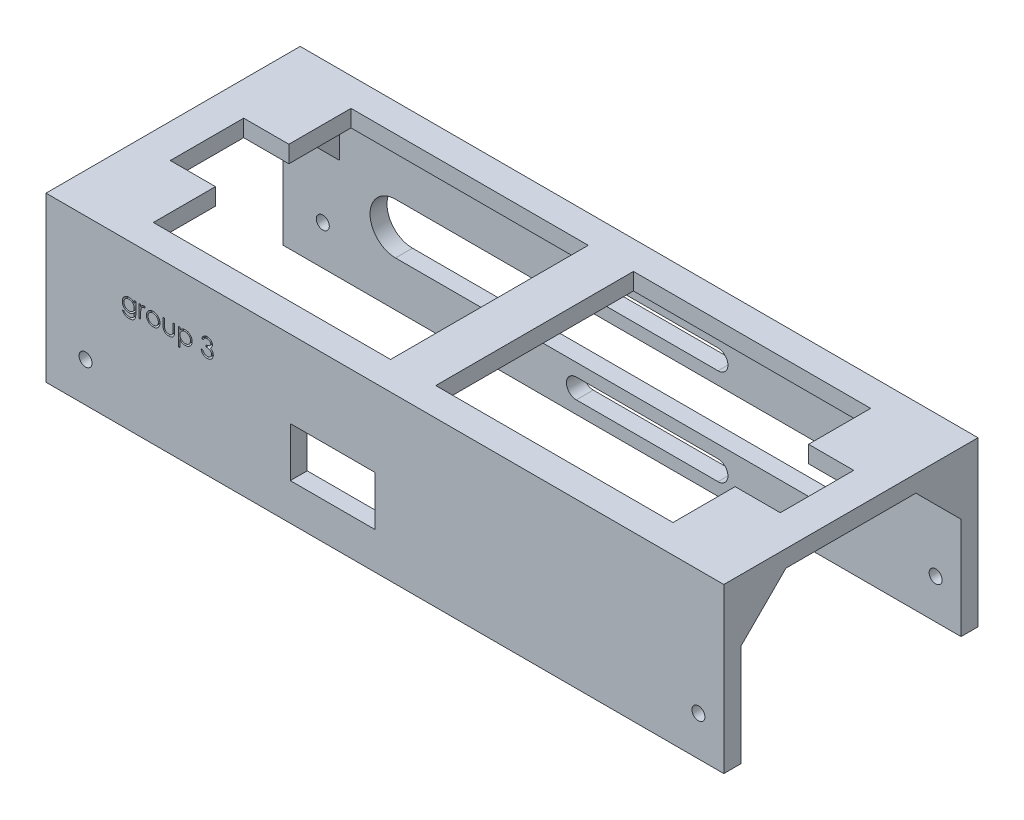
from build123d import *

# Parameters (mm, degrees)
SKETCH1_W           = 120
SKETCH1_H           = 29
BOSS_EXTRUDE5_DEPTH = 45
SHELL9_T            = -3
SKETCH3_R           = 1.15
CUT_EXTRUDE2_DEPTH  = 79
CUT_EXTRUDE8_DEPTH  = 23
SKETCH7_W           = 15
SKETCH7_H           = 8.75
CUT_EXTRUDE9_DEPTH  = 20
SKETCH13_W          = 50
SKETCH13_H          = 35
CUT_EXTRUDE14_DEPTH = 10
SKETCH17_W          = 8
SKETCH17_H          = 11
BOSS_EXTRUDE6_DEPTH = 3
CUT_EXTRUDE15_DEPTH = 1.5
BOSS_EXTRUDE7_DEPTH = 10
BOSS_EXTRUDE8_DEPTH = 10


with BuildPart() as part:
    # Sketch1 → Boss-Extrude5 (new body)
    with BuildSketch(Plane.XY):
        with Locations((60, 14.5)):
            Rectangle(SKETCH1_W, SKETCH1_H)
    extrude(amount=BOSS_EXTRUDE5_DEPTH)

    # Shell9
    shell9_openings = [part.faces().sort_by_distance(p)[0] for p in [
        (120, 14.5, 22.5),
        (60, 0, 22.5),
        (0, 14.5, 22.5),
    ]]
    offset(amount=SHELL9_T, openings=shell9_openings, kind=Kind.INTERSECTION)

    # Sketch3 → Cut-Extrude2 (cut)
    with BuildSketch(Plane(origin=(0, 0, 0), x_dir=(-1, 0, 0), z_dir=(0, 0, -1))):
        with Locations((-7, 7)):
            Circle(SKETCH3_R)
        with Locations((-115.5, 7)):
            Circle(SKETCH3_R)
    extrude(amount=-CUT_EXTRUDE2_DEPTH, mode=Mode.SUBTRACT)

    # Sketch6 → Cut-Extrude8 (cut)
    with BuildSketch(Plane(origin=(0, 0, 0), x_dir=(-1, 0, 0), z_dir=(0, 0, -1))):
        with BuildLine():
            Line((-51.883496676, 22.75), (-76.973496676, 22.75))
            ThreePointArc((-76.973496676, 22.75), (-78.723496676, 21), (-76.973496676, 19.25))
            Line((-76.973496676, 19.25), (-51.883496676, 19.25))
            ThreePointArc((-51.883496676, 19.25), (-50.133496676, 21), (-51.883496676, 22.75))
        make_face()
        with BuildLine():
            Line((-19.873496676, 17), (-94.873496676, 17))
            ThreePointArc((-94.873496676, 17), (-99.373496676, 12.5), (-94.873496676, 8))
            Line((-94.873496676, 8), (-19.873496676, 8))
            ThreePointArc((-19.873496676, 8), (-15.373496676, 12.5), (-19.873496676, 17))
        make_face()
        with BuildLine():
            ThreePointArc((-76.973496676, 5.75), (-78.723496676, 4), (-76.973496676, 2.25))
            Line((-76.973496676, 2.25), (-51.883496676, 2.25))
            ThreePointArc((-51.883496676, 2.25), (-50.133496676, 4), (-51.883496676, 5.75))
            Line((-51.883496676, 5.75), (-76.973496676, 5.75))
        make_face()
    extrude(amount=-CUT_EXTRUDE8_DEPTH, mode=Mode.SUBTRACT)

    # Sketch7 → Cut-Extrude9 (cut)
    with BuildSketch(Plane.XY.offset(45)):
        with Locations((50.746172795, 10.921245049)):
            Rectangle(SKETCH7_W, SKETCH7_H)
    extrude(amount=-CUT_EXTRUDE9_DEPTH, mode=Mode.SUBTRACT)

    # Sketch13 → Cut-Extrude14 (cut)
    with BuildSketch(Plane(origin=(0, 29, 0), x_dir=(1, 0, 0), z_dir=(0, 1, 0))):
        with Locations((89, -22.5)):
            Rectangle(SKETCH13_W, SKETCH13_H)
        with Locations((31, -22.5)):
            Rectangle(SKETCH13_W, SKETCH13_H)
    extrude(amount=-CUT_EXTRUDE14_DEPTH, mode=Mode.SUBTRACT)

    # Sketch17 → Boss-Extrude6 (add)
    with BuildSketch(Plane(origin=(0, 29, 0), x_dir=(1, 0, 0), z_dir=(0, 1, 0))):
        with Locations((10, -10.5)):
            Rectangle(SKETCH17_W, SKETCH17_H)
        with Locations((10, -34.5)):
            Rectangle(SKETCH17_W, SKETCH17_H)
        with Locations((110, -10.5)):
            Rectangle(SKETCH17_W, SKETCH17_H)
        with Locations((110, -34.5)):
            Rectangle(SKETCH17_W, SKETCH17_H)
    extrude(amount=-BOSS_EXTRUDE6_DEPTH)

    # Sketch20 → Cut-Extrude15 (cut)
    # profile 1 of 6: a face of its own
    with BuildSketch(Plane.XY.offset(45)):
        with BuildLine():
            Line((15.616704574, 20.332761713), (15.901640472, 20.332761713))
            Line((15.901640472, 20.332761713), (15.901640472, 18.49149068))
            add(Edge.make_bspline(
                [(15.901640472, 18.49149068), (15.901389155, 18.452268005), (15.900904052, 18.376558794), (15.897410671, 18.267086354), (15.890044057, 18.165970691), (15.881690467, 18.072750642), (15.869673803, 17.9878583), (15.854999527, 17.91104035), (15.838457161, 17.842223075), (15.823924535, 17.799836969), (15.817050127, 17.779786954)],
                knots=[0, 0, 0, 0, 1.307562039, 2.523909702, 3.650326591, 4.686913197, 5.643429486, 6.506965704, 7.293745905, 8, 8, 8, 8], degree=3))
            add(Edge.make_bspline(
                [(15.817050127, 17.779786954), (15.806899889, 17.753724811), (15.786902899, 17.702379766), (15.749450931, 17.629595775), (15.707510176, 17.561064407), (15.659606909, 17.497167576), (15.605957751, 17.438226048), (15.547826683, 17.382959277), (15.484081581, 17.332536497), (15.414758892, 17.287827692), (15.341456639, 17.247562292), (15.264216961, 17.212685764), (15.183475406, 17.182308413), (15.098473497, 17.159554734), (15.010543928, 17.139838237), (14.918652687, 17.127006986), (14.823336649, 17.118273869), (14.758525483, 17.117466301), (14.725643877, 17.117056585)],
                knots=[0, 0, 0, 0, 0.981931301, 1.934503488, 2.87077864, 3.801706999, 4.735015492, 5.667491629, 6.616593066, 7.585388521, 8.561939025, 9.551802639, 10.560317337, 11.588439944, 12.640189604, 13.723962949, 14.845264515, 16, 16, 16, 16], degree=3))
            add(Edge.make_bspline(
                [(14.725643877, 17.117056585), (14.677669868, 17.11783354), (14.583963739, 17.119351142), (14.447343495, 17.137032186), (14.317590571, 17.162027939), (14.196419457, 17.19986072), (14.084595869, 17.246158561), (13.982883496, 17.299312554), (13.89219542, 17.360262855), (13.810440374, 17.429659829), (13.736651931, 17.512176883), (13.667230747, 17.609421549), (13.600409749, 17.722875084), (13.561249628, 17.806144188), (13.540743036, 17.849748893)],
                knots=[0, 0, 0, 0, 1.157897085, 2.2616841, 3.32207898, 4.345638746, 5.321241055, 6.241986252, 7.112515963, 7.955008012, 8.825025602, 9.77857164, 10.836726669, 12, 12, 12, 12], degree=3))
            Line((13.540743036, 17.849748893), (13.825678933, 17.849748893))
            add(Edge.make_bspline(
                [(13.825678933, 17.849748893), (13.848595366, 17.813367134), (13.89339417, 17.742245276), (13.977167435, 17.650158342), (14.068976031, 17.571460647), (14.171918315, 17.508041587), (14.286422618, 17.460226276), (14.412557826, 17.426140115), (14.55135034, 17.405732787), (14.647977577, 17.403273256), (14.698295119, 17.401992483)],
                knots=[0, 0, 0, 0, 0.997731894, 1.950442991, 2.880492273, 3.800895997, 4.748200782, 5.754801363, 6.83083817, 8, 8, 8, 8], degree=3))
            add(Edge.make_bspline(
                [(14.698295119, 17.401992483), (14.747976513, 17.403289832), (14.843757266, 17.405790991), (14.981489827, 17.426149222), (15.107215235, 17.460233694), (15.220209131, 17.507957016), (15.319138293, 17.566422742), (15.404420599, 17.631737095), (15.473494698, 17.705379862), (15.519952175, 17.773217644), (15.548830721, 17.833655247), (15.567220536, 17.885682245), (15.582164779, 17.944513069), (15.594665061, 18.009950487), (15.604980103, 18.08208799), (15.611514147, 18.161090521), (15.616236561, 18.246778529), (15.616544963, 18.306190162), (15.616704574, 18.336938396)],
                knots=[0, 0, 0, 0, 1.570740765, 3.028230971, 4.391408896, 5.680370741, 6.894727393, 8.017376726, 9.065722033, 10.075533815, 10.603371122, 11.180248986, 11.817768598, 12.521299649, 13.286540596, 14.121245857, 15.027658897, 16, 16, 16, 16], degree=3))
            Line((15.616704574, 18.336938396), (15.616704574, 18.457145728))
            add(Edge.make_bspline(
                [(15.616704574, 18.457145728), (15.587783846, 18.422727093), (15.530451097, 18.354495237), (15.431438879, 18.265085752), (15.323292106, 18.188081905), (15.206194892, 18.124927858), (15.083015558, 18.074416852), (14.955088249, 18.039090023), (14.823559742, 18.016266399), (14.734431006, 18.013810477), (14.689390872, 18.012569406)],
                knots=[0, 0, 0, 0, 1.012485704, 2.007162095, 2.997754123, 3.998611389, 4.999708251, 5.992315798, 6.98544096, 8, 8, 8, 8], degree=3))
            add(Edge.make_bspline(
                [(14.689390872, 18.012569406), (14.662869399, 18.013036608), (14.610140308, 18.013965485), (14.531804216, 18.022092376), (14.454624104, 18.033884092), (14.378779973, 18.051193683), (14.304162381, 18.073411178), (14.230894637, 18.101184934), (14.158383509, 18.132585791), (14.087947043, 18.169572548), (14.020286767, 18.210722641), (13.955913021, 18.255298635), (13.895162989, 18.303067225), (13.838614888, 18.354499449), (13.786342893, 18.409520868), (13.737643956, 18.467544948), (13.693323362, 18.52938192), (13.652471645, 18.593904232), (13.617040867, 18.661541641), (13.585940044, 18.730827485), (13.558898655, 18.801613615), (13.537340041, 18.874137022), (13.520874388, 18.948351984), (13.508618682, 19.02413692), (13.501667308, 19.1017252), (13.500583341, 19.153995995), (13.500037908, 19.180297771)],
                knots=[0, 0, 0, 0, 1.028754217, 2.045334182, 3.052854819, 4.056607503, 5.061168794, 6.071104265, 7.095078842, 8.125279047, 9.155117945, 10.165957491, 11.161587969, 12.151493252, 13.128948131, 14.104219989, 15.088194871, 16.07871515, 17.064853787, 18.047899887, 19.02414258, 20.002704429, 20.980574569, 21.971845993, 22.979467364, 24, 24, 24, 24], degree=3))
            add(Edge.make_bspline(
                [(13.500037908, 19.180297771), (13.500508866, 19.206607723), (13.501448958, 19.259125723), (13.509568775, 19.337030594), (13.521151346, 19.413892296), (13.53948268, 19.488918582), (13.561546682, 19.562963892), (13.588873066, 19.635481306), (13.621728655, 19.706492911), (13.658930356, 19.776051293), (13.700735212, 19.843223058), (13.746575391, 19.907019373), (13.796506234, 19.966970786), (13.8498389, 20.023682111), (13.907224591, 20.07660618), (13.96863362, 20.125614541), (14.033460661, 20.171528693), (14.101906631, 20.213358264), (14.172915405, 20.250353587), (14.24468294, 20.284110729), (14.31815991, 20.310902394), (14.391976428, 20.334509063), (14.467432493, 20.351232418), (14.543602915, 20.364134024), (14.620748464, 20.371994163), (14.672412876, 20.372975315), (14.698295119, 20.373466842)],
                knots=[0, 0, 0, 0, 1.008818848, 2.013730394, 3.001654427, 3.987803273, 4.973046549, 5.963777569, 6.957074694, 7.972068341, 8.987420212, 9.989399531, 10.982630087, 11.977756091, 12.973280677, 13.973972381, 14.989194003, 16.018387222, 17.047741039, 18.059210846, 19.057554164, 20.045176975, 21.029480261, 22.018708529, 23.007435371, 24, 24, 24, 24], degree=3))
            add(Edge.make_bspline(
                [(14.698295119, 20.373466842), (14.740977042, 20.372236145), (14.825260726, 20.369805898), (14.949295278, 20.350736716), (15.068985739, 20.320334718), (15.18500751, 20.276777682), (15.298305708, 20.217314433), (15.408506924, 20.138989044), (15.515929996, 20.04109895), (15.582222028, 19.966030281), (15.616704574, 19.926982467)],
                knots=[0, 0, 0, 0, 0.96728863, 1.910097829, 2.838038873, 3.762875196, 4.71315279, 5.730631239, 6.819562287, 8, 8, 8, 8], degree=3))
            Line((15.616704574, 19.926982467), (15.616704574, 20.332761713))
        make_face()
        with BuildLine():
            add(Edge.make_bspline(
                [(14.721191754, 20.088530944), (14.679526044, 20.087114835), (14.597036773, 20.084311238), (14.476125205, 20.060376534), (14.359396844, 20.022869897), (14.249083349, 19.969219095), (14.145753328, 19.903819322), (14.054064026, 19.824589204), (13.973868138, 19.734105154), (13.90602933, 19.633185287), (13.852025876, 19.524307938), (13.813795774, 19.409544629), (13.78907611, 19.290749742), (13.78634774, 19.209676024), (13.784973805, 19.168849454)],
                knots=[0, 0, 0, 0, 1.026226791, 2.031711442, 3.026614839, 4.04107745, 5.047145931, 6.032893242, 7.017642609, 8.019221815, 9.021877557, 10.003543541, 10.994637589, 12, 12, 12, 12], degree=3))
            add(Edge.make_bspline(
                [(13.784973805, 19.168849454), (13.78563217, 19.138067128), (13.786926982, 19.077527295), (13.799376227, 18.988683633), (13.819497532, 18.904065063), (13.848015569, 18.823666466), (13.883351228, 18.747026688), (13.927794307, 18.674673668), (13.980091974, 18.60654297), (14.039834895, 18.543138509), (14.105672041, 18.485388916), (14.177081601, 18.434645122), (14.25396672, 18.393142682), (14.334436469, 18.357273494), (14.42044337, 18.331076054), (14.510748612, 18.311083733), (14.605991079, 18.299645788), (14.670916871, 18.298228108), (14.704019278, 18.297505303)],
                knots=[0, 0, 0, 0, 1.039728707, 2.044842319, 3.024901384, 3.974314358, 4.923051295, 5.871625912, 6.837440708, 7.820715446, 8.810779094, 9.792721783, 10.773906224, 11.758876063, 12.764959493, 13.806266761, 14.881525401, 16, 16, 16, 16], degree=3))
            add(Edge.make_bspline(
                [(14.704019278, 18.297505303), (14.737550687, 18.298201634), (14.803121003, 18.299563302), (14.898888923, 18.311268619), (14.989632909, 18.330157126), (15.075269755, 18.356975013), (15.1561228, 18.39119403), (15.231283772, 18.434497961), (15.302364264, 18.483814268), (15.367094722, 18.541338023), (15.425627358, 18.604733697), (15.476636696, 18.673717281), (15.520101946, 18.747250752), (15.556095261, 18.825325821), (15.583573711, 18.908549241), (15.60200586, 18.996712964), (15.614893407, 19.089394606), (15.616091675, 19.152902422), (15.616704574, 19.185385912)],
                knots=[0, 0, 0, 0, 1.121943988, 2.193949579, 3.223793937, 4.220241907, 5.192961521, 6.155822191, 7.11847367, 8.083710714, 9.04790392, 10.001595906, 10.949595423, 11.902125208, 12.873731292, 13.87582262, 14.913508608, 16, 16, 16, 16], degree=3))
            add(Edge.make_bspline(
                [(15.616704574, 19.185385912), (15.615489395, 19.227674965), (15.613115361, 19.310292915), (15.59071151, 19.430676912), (15.554588891, 19.543859923), (15.503927909, 19.649483987), (15.440444229, 19.746429935), (15.363980388, 19.83290228), (15.27585506, 19.909012343), (15.176321441, 19.97241999), (15.069235544, 20.023642205), (14.957184173, 20.062070384), (14.840333683, 20.083836656), (14.761134297, 20.086957176), (14.721191754, 20.088530944)],
                knots=[0, 0, 0, 0, 1.070913519, 2.092188694, 3.091357305, 4.074328408, 5.051968682, 6.018948707, 6.99050112, 7.9935919, 9.000589572, 9.992915277, 10.987769056, 12, 12, 12, 12], degree=3))
        make_face(mode=Mode.SUBTRACT)
    # profile 2 of 6: a face of its own
    with BuildSketch(Plane.XY.offset(45)):
        with BuildLine():
            Line((16.471512267, 20.332761713), (16.756448164, 20.332761713))
            Line((16.756448164, 20.332761713), (16.756448164, 19.991220247))
            add(Edge.make_bspline(
                [(16.756448164, 19.991220247), (16.777483681, 20.023020891), (16.817713944, 20.083839376), (16.884582101, 20.1642751), (16.953074409, 20.230873035), (17.023518757, 20.283944084), (17.096433176, 20.323688842), (17.170217411, 20.352801809), (17.246032302, 20.370016945), (17.29697919, 20.372315336), (17.322503853, 20.373466842)],
                knots=[0, 0, 0, 0, 1.2804753, 2.448899062, 3.506932113, 4.484331642, 5.4025378, 6.288909075, 7.142734305, 8, 8, 8, 8], degree=3))
            add(Edge.make_bspline(
                [(17.322503853, 20.373466842), (17.342303449, 20.372386864), (17.383042405, 20.37016474), (17.444712326, 20.354552063), (17.508251743, 20.329625571), (17.549202337, 20.306184798), (17.570550728, 20.293964638)],
                knots=[0, 0, 0, 0, 0.901110191, 1.854092781, 2.881294221, 4, 4, 4, 4], degree=3))
            Line((17.570550728, 20.293964638), (17.414090392, 20.047189798))
            add(Edge.make_bspline(
                [(17.414090392, 20.047189798), (17.400384351, 20.053304183), (17.374367662, 20.064910455), (17.336308877, 20.078646421), (17.301219379, 20.08673443), (17.278864151, 20.087959724), (17.268442355, 20.088530944)],
                knots=[0, 0, 0, 0, 1.180555205, 2.24091978, 3.179933427, 4, 4, 4, 4], degree=3))
            add(Edge.make_bspline(
                [(17.268442355, 20.088530944), (17.245577154, 20.08700691), (17.198938771, 20.083898323), (17.130463547, 20.059460976), (17.064017868, 20.019977365), (17.01124786, 19.976188571), (16.970388102, 19.933963069), (16.941232326, 19.897089161), (16.914487262, 19.855742831), (16.888932848, 19.810630903), (16.865649853, 19.760983115), (16.843919546, 19.707295485), (16.824271863, 19.649505833), (16.813068427, 19.609244546), (16.807329574, 19.588621088)],
                knots=[0, 0, 0, 0, 1.125678352, 2.296057538, 3.5422874, 4.923748041, 5.663163013, 6.437101912, 7.23742474, 8.08941207, 8.991984279, 9.93940061, 10.944477711, 12, 12, 12, 12], degree=3))
            add(Edge.make_bspline(
                [(16.807329574, 19.588621088), (16.803036618, 19.570226795), (16.793528044, 19.529484834), (16.784282864, 19.461132958), (16.775148372, 19.380375782), (16.768710726, 19.286988515), (16.762743502, 19.18120437), (16.759377927, 19.06286219), (16.756562935, 18.931840507), (16.756487582, 18.840242344), (16.756448164, 18.792327018)],
                knots=[0, 0, 0, 0, 0.566838948, 1.255505196, 2.06880316, 3.007127437, 4.065329342, 5.249902469, 6.561414163, 8, 8, 8, 8], degree=3))
            Line((16.756448164, 18.792327018), (16.756448164, 18.012569406))
            Line((16.756448164, 18.012569406), (16.471512267, 18.012569406))
            Line((16.471512267, 18.012569406), (16.471512267, 20.332761713))
        make_face()
    # profile 3 of 6: a face of its own
    with BuildSketch(Plane.XY.offset(45)):
        with BuildLine():
            add(Edge.make_bspline(
                [(18.976149687, 20.373466842), (19.019684627, 20.37253984), (19.105046006, 20.370722218), (19.230057445, 20.351295784), (19.349387675, 20.321589247), (19.463493721, 20.280521473), (19.570914218, 20.225474275), (19.673213846, 20.159788703), (19.770112133, 20.081971636), (19.828190167, 20.021775389), (19.857670119, 19.991220247)],
                knots=[0, 0, 0, 0, 1.054011418, 2.066658804, 3.057071809, 4.030435133, 4.997543892, 5.974964718, 6.972108034, 8, 8, 8, 8], degree=3))
            add(Edge.make_bspline(
                [(19.857670119, 19.991220247), (19.883053749, 19.96199756), (19.933329765, 19.904117725), (19.997796525, 19.810268705), (20.053333226, 19.713077328), (20.09784034, 19.611252967), (20.132933183, 19.505684516), (20.157848493, 19.39600912), (20.172668427, 19.282468991), (20.174666833, 19.205358366), (20.175678933, 19.166305383)],
                knots=[0, 0, 0, 0, 1.025258237, 2.030674902, 3.01204498, 3.988269485, 4.97094183, 5.956517959, 6.965070386, 8, 8, 8, 8], degree=3))
            add(Edge.make_bspline(
                [(20.175678933, 19.166305383), (20.17478872, 19.127026045), (20.173029618, 19.049408242), (20.156389337, 18.935090674), (20.130507566, 18.824242513), (20.093467256, 18.717327841), (20.045970971, 18.614019848), (19.98801299, 18.514769757), (19.919186595, 18.41938175), (19.841168683, 18.328665797), (19.754943053, 18.245057873), (19.661401975, 18.172188657), (19.562383673, 18.109757703), (19.456571489, 18.059468955), (19.344931697, 18.019818012), (19.227223499, 17.991968712), (19.103629757, 17.975130613), (19.019240778, 17.972968371), (18.976149687, 17.971864278)],
                knots=[0, 0, 0, 0, 0.998656419, 1.973391657, 2.932242238, 3.890759089, 4.846373663, 5.82037756, 6.809684879, 7.83454468, 8.860553229, 9.859544525, 10.845671541, 11.83227036, 12.833544569, 13.85385346, 14.904124723, 16, 16, 16, 16], degree=3))
            add(Edge.make_bspline(
                [(18.976149687, 17.971864278), (18.932847477, 17.972972077), (18.848037911, 17.975141758), (18.724007913, 17.991903293), (18.606088759, 18.019805177), (18.494302816, 18.05959926), (18.388035705, 18.10975931), (18.288443668, 18.171999915), (18.194826602, 18.245079484), (18.10858273, 18.328659941), (18.03056971, 18.419383259), (17.961742052, 18.514769365), (17.903784399, 18.61401995), (17.856288029, 18.717327814), (17.819247741, 18.824242521), (17.793365964, 18.935090672), (17.776725685, 19.049408242), (17.774966583, 19.127026045), (17.774076369, 19.166305383)],
                knots=[0, 0, 0, 0, 1.099876186, 2.154163076, 3.173186993, 4.173200201, 5.163417411, 6.152872554, 7.150605724, 8.17532212, 9.198891216, 10.186952605, 11.159729845, 12.11414092, 13.071450619, 14.029093627, 15.002601286, 16, 16, 16, 16], degree=3))
            add(Edge.make_bspline(
                [(17.774076369, 19.166305383), (17.775095372, 19.205146107), (17.777112823, 19.282044065), (17.791917856, 19.395370756), (17.816735975, 19.50486053), (17.851870885, 19.610021498), (17.896788237, 19.711399643), (17.951544548, 19.808831168), (18.016668907, 19.902255816), (18.066744963, 19.960060846), (18.092085183, 19.989312194)],
                knots=[0, 0, 0, 0, 1.031353054, 2.041901799, 3.029428768, 4.008703097, 4.981709435, 5.96992636, 6.972712378, 8, 8, 8, 8], degree=3))
            add(Edge.make_bspline(
                [(18.092085183, 19.989312194), (18.121520691, 20.020132318), (18.179410796, 20.080745514), (18.276791428, 20.158335732), (18.378839394, 20.22538817), (18.487447005, 20.279341594), (18.601459312, 20.321830821), (18.721401054, 20.351372396), (18.8468367, 20.370652225), (18.932615785, 20.372519286), (18.976149687, 20.373466842)],
                knots=[0, 0, 0, 0, 1.027980169, 2.021703884, 2.998553061, 3.971491411, 4.943284454, 5.930300938, 6.949603206, 8, 8, 8, 8], degree=3))
        make_face()
        with BuildLine():
            add(Edge.make_bspline(
                [(18.974877651, 20.088530944), (18.94409139, 20.087655922), (18.883313609, 20.085928465), (18.793851557, 20.072789495), (18.707727274, 20.05197283), (18.624777366, 20.022396294), (18.545281559, 19.984206578), (18.469163744, 19.937299709), (18.396200031, 19.882296955), (18.327817731, 19.819284389), (18.26505949, 19.750451301), (18.210197326, 19.67711029), (18.163547408, 19.600450961), (18.124685264, 19.520393598), (18.095740886, 19.436126908), (18.074719644, 19.348605193), (18.061593069, 19.257650137), (18.059881854, 19.195818356), (18.059012267, 19.16439733)],
                knots=[0, 0, 0, 0, 1.021534396, 2.016698045, 2.994645724, 3.958388632, 4.93408049, 5.916473867, 6.921342795, 7.962252576, 8.998418191, 10.008913653, 10.997312074, 11.973003931, 12.956656626, 13.948281152, 14.957379055, 16, 16, 16, 16], degree=3))
            add(Edge.make_bspline(
                [(18.059012267, 19.16439733), (18.060469885, 19.123800849), (18.063362986, 19.043224424), (18.08688995, 18.924560048), (18.126247504, 18.810639368), (18.179394536, 18.702130218), (18.245984463, 18.601734651), (18.324440588, 18.512225519), (18.413920888, 18.434949819), (18.513358713, 18.370832194), (18.620722987, 18.319887273), (18.734348364, 18.283783917), (18.852858136, 18.260314596), (18.933848514, 18.257981901), (18.974877651, 18.256800175)],
                knots=[0, 0, 0, 0, 1.016792936, 2.018143844, 3.017858371, 4.030088057, 5.03801393, 6.028138512, 7.003788237, 7.991172063, 8.984598303, 9.972568034, 10.972917682, 12, 12, 12, 12], degree=3))
            add(Edge.make_bspline(
                [(18.974877651, 18.256800175), (19.015904429, 18.257988786), (19.096890148, 18.260335072), (19.215235258, 18.283665716), (19.328550076, 18.320045465), (19.435802834, 18.370774898), (19.535195396, 18.435193303), (19.625319242, 18.51178916), (19.703105482, 18.601971725), (19.769629538, 18.702263197), (19.82364694, 18.810471145), (19.862820273, 18.924581074), (19.886403798, 19.043219069), (19.889289264, 19.123799055), (19.890743036, 19.16439733)],
                knots=[0, 0, 0, 0, 1.02726834, 2.027799167, 3.010890988, 4.004497153, 4.992059811, 5.971914811, 6.958719428, 7.966827853, 8.981595046, 9.981490638, 10.983022906, 12, 12, 12, 12], degree=3))
            add(Edge.make_bspline(
                [(19.890743036, 19.16439733), (19.889873748, 19.195818544), (19.888163122, 19.257650694), (19.875032262, 19.348603063), (19.854026879, 19.436134725), (19.825024055, 19.520364757), (19.786330771, 19.600658243), (19.738781252, 19.67688521), (19.684143107, 19.750705362), (19.620627576, 19.819061879), (19.552316655, 19.882321519), (19.47932337, 19.937321037), (19.403318425, 19.984000427), (19.324053568, 20.022722945), (19.241093025, 20.051703747), (19.155089415, 20.072909691), (19.066009066, 20.085872941), (19.005449077, 20.087639276), (18.974877651, 20.088530944)],
                knots=[0, 0, 0, 0, 1.042956736, 2.052379634, 3.044323526, 4.02829302, 5.004299113, 5.996692471, 7.007513377, 8.048758398, 9.090003419, 10.095195979, 11.07790575, 12.047570684, 13.018257071, 13.989683339, 14.985167495, 16, 16, 16, 16], degree=3))
        make_face(mode=Mode.SUBTRACT)
    # profile 4 of 6: a face of its own
    with BuildSketch(Plane.XY.offset(45)):
        with BuildLine():
            Line((20.7048456, 20.332761713), (20.989781497, 20.332761713))
            Line((20.989781497, 20.332761713), (20.989781497, 19.256619887))
            add(Edge.make_bspline(
                [(20.989781497, 19.256619887), (20.989910225, 19.225030678), (20.990156476, 19.164602003), (20.991826473, 19.077647655), (20.995754486, 18.998348208), (21.000665598, 18.926657854), (21.00698125, 18.86258872), (21.014495442, 18.806364589), (21.022894153, 18.757347865), (21.031115329, 18.727826393), (21.034938749, 18.71409685)],
                knots=[0, 0, 0, 0, 1.388932606, 2.656963016, 3.823490214, 4.879454478, 5.816252168, 6.653371382, 7.373723809, 8, 8, 8, 8], degree=3))
            add(Edge.make_bspline(
                [(21.034938749, 18.71409685), (21.041072355, 18.696840388), (21.05321205, 18.662686223), (21.075231567, 18.613347625), (21.102471558, 18.567650048), (21.132280116, 18.523831353), (21.166660293, 18.483189551), (21.205177099, 18.445793272), (21.246541214, 18.410229561), (21.3080047, 18.368151928), (21.392059891, 18.323053022), (21.502416319, 18.284140387), (21.622072295, 18.260885035), (21.704771719, 18.258186961), (21.747278493, 18.256800175)],
                knots=[0, 0, 0, 0, 0.725840625, 1.436591201, 2.137033971, 2.831655856, 3.53531722, 4.242432219, 4.957935707, 5.694543706, 7.190802206, 8.724350549, 10.316345118, 12, 12, 12, 12], degree=3))
            add(Edge.make_bspline(
                [(21.747278493, 18.256800175), (21.789781318, 18.258216451), (21.872016419, 18.260956682), (21.990357713, 18.283438892), (22.098535782, 18.320999767), (22.195464859, 18.373439347), (22.2807053, 18.437612504), (22.351738594, 18.512913352), (22.410346603, 18.596959582), (22.435936578, 18.659665178), (22.448805937, 18.691200215)],
                knots=[0, 0, 0, 0, 1.157059328, 2.238695713, 3.266970494, 4.264342957, 5.228770407, 6.160125903, 7.074715775, 8, 8, 8, 8], degree=3))
            add(Edge.make_bspline(
                [(22.448805937, 18.691200215), (22.452610702, 18.703869643), (22.46102211, 18.731878654), (22.470059386, 18.779394569), (22.478200505, 18.836058889), (22.485152101, 18.902242407), (22.490109784, 18.977772166), (22.492782251, 19.062624564), (22.495801472, 19.156533227), (22.495847297, 19.222271837), (22.495871241, 19.256619887)],
                knots=[0, 0, 0, 0, 0.557542046, 1.232589297, 2.036731608, 2.971723315, 4.038036528, 5.22795436, 6.551621927, 8, 8, 8, 8], degree=3))
            Line((22.495871241, 19.256619887), (22.495871241, 20.332761713))
            Line((22.495871241, 20.332761713), (22.780807138, 20.332761713))
            Line((22.780807138, 20.332761713), (22.780807138, 19.203194406))
            add(Edge.make_bspline(
                [(22.780807138, 19.203194406), (22.780406458, 19.164815757), (22.779629084, 19.09035593), (22.774633136, 18.9821482), (22.766060988, 18.881308163), (22.753050123, 18.787782443), (22.737750547, 18.701642441), (22.7180145, 18.622777758), (22.694448527, 18.551431377), (22.667864238, 18.486351337), (22.636457258, 18.427344511), (22.60304989, 18.371341306), (22.564473847, 18.319731286), (22.523860848, 18.269945348), (22.478683632, 18.224459819), (22.42978876, 18.18223098), (22.377864429, 18.142613302), (22.321758371, 18.107151927), (22.262289657, 18.075205398), (22.199384872, 18.046887956), (22.132273538, 18.02447919), (22.061821525, 18.005147372), (21.98768366, 17.98998496), (21.909931418, 17.97929286), (21.828590988, 17.972738453), (21.773155978, 17.972160562), (21.744734422, 17.971864278)],
                knots=[0, 0, 0, 0, 1.493040784, 2.896703357, 4.213163133, 5.428574705, 6.569057535, 7.615249723, 8.588095153, 9.490268104, 10.346124644, 11.18633936, 12.024365274, 12.850166724, 13.684164916, 14.514361689, 15.362232829, 16.222528818, 17.093394965, 17.986930858, 18.902426812, 19.842810585, 20.827885679, 21.843828298, 22.894529745, 24, 24, 24, 24], degree=3))
            add(Edge.make_bspline(
                [(21.744734422, 17.971864278), (21.716525441, 17.97217244), (21.661092168, 17.972778009), (21.57974754, 17.979256649), (21.501779875, 17.989968347), (21.427466371, 18.005258437), (21.356732454, 18.024343879), (21.289291607, 18.047025657), (21.225933518, 18.075220094), (21.165896986, 18.106949736), (21.109651962, 18.142841093), (21.056939181, 18.1821821), (21.007829322, 18.224914029), (20.962311553, 18.270858417), (20.921024781, 18.320585209), (20.883454515, 18.373694396), (20.849022361, 18.429659748), (20.817859472, 18.489588474), (20.791088094, 18.555421654), (20.767452264, 18.628262592), (20.748120471, 18.708909875), (20.732388374, 18.797294553), (20.719732425, 18.892993627), (20.71094571, 18.996560689), (20.706032778, 19.107743467), (20.705249858, 19.18453301), (20.7048456, 19.224182988)],
                knots=[0, 0, 0, 0, 1.083640291, 2.129454052, 3.13281866, 4.105697902, 5.042300162, 5.946461698, 6.836384745, 7.703652036, 8.553297018, 9.397182691, 10.228592656, 11.052265423, 11.879314572, 12.708807002, 13.549817954, 14.402308542, 15.300838682, 16.27712199, 17.341985831, 18.484375296, 19.725102775, 21.0496083, 22.476576903, 24, 24, 24, 24], degree=3))
            Line((20.7048456, 19.224182988), (20.7048456, 20.332761713))
        make_face()
    # profile 5 of 6: a face of its own
    with BuildSketch(Plane.XY.offset(45)):
        with BuildLine():
            Line((23.43208919, 20.332761713), (23.717025087, 20.332761713))
            Line((23.717025087, 20.332761713), (23.717025087, 19.903449814))
            add(Edge.make_bspline(
                [(23.717025087, 19.903449814), (23.747285091, 19.942400473), (23.806089351, 20.018093283), (23.907439801, 20.116055757), (24.014416263, 20.198674068), (24.129771645, 20.263428223), (24.251713135, 20.312251388), (24.379740309, 20.348337032), (24.51493976, 20.369601798), (24.607374399, 20.372161448), (24.654515071, 20.373466842)],
                knots=[0, 0, 0, 0, 1.0828784, 2.104357462, 3.088488658, 4.04616522, 5.001424249, 5.969181776, 6.964304535, 8, 8, 8, 8], degree=3))
            add(Edge.make_bspline(
                [(24.654515071, 20.373466842), (24.69569174, 20.372275601), (24.777079588, 20.369921051), (24.896879803, 20.35397978), (25.012246044, 20.32665873), (25.122525636, 20.2872879), (25.228899988, 20.238614724), (25.329794321, 20.177185698), (25.42678019, 20.106060082), (25.517418447, 20.024206631), (25.601167116, 19.935643847), (25.673599009, 19.840373614), (25.736075665, 19.741528982), (25.786576577, 19.637577584), (25.826135578, 19.529337997), (25.854270321, 19.416372911), (25.87101404, 19.299101165), (25.873260536, 19.21936084), (25.874396882, 19.179025736)],
                knots=[0, 0, 0, 0, 1.041296284, 2.058176809, 3.050446431, 4.034000596, 5.01514041, 6.003636468, 7.015969324, 8.052561599, 9.08815499, 10.094063707, 11.074456064, 12.040834395, 13.011057502, 13.983766392, 14.980127149, 16, 16, 16, 16], degree=3))
            add(Edge.make_bspline(
                [(25.874396882, 19.179025736), (25.873285192, 19.137839356), (25.871092778, 19.056613871), (25.854088379, 18.93733629), (25.826913215, 18.822594172), (25.787853292, 18.712578369), (25.737378513, 18.607364628), (25.675960805, 18.507028826), (25.603492367, 18.41160311), (25.520669201, 18.322382979), (25.430814037, 18.240196459), (25.334768029, 18.16831621), (25.234021718, 18.107953677), (25.129090538, 18.057531992), (25.019076209, 18.019529797), (24.904492021, 17.992117935), (24.785400359, 17.975213785), (24.704391457, 17.972989342), (24.663419318, 17.971864278)],
                knots=[0, 0, 0, 0, 1.038740735, 2.04854663, 3.033179607, 4.009277356, 4.987731542, 5.972001279, 6.972200261, 8.005528982, 9.039189865, 10.040446548, 11.026516639, 11.997840187, 12.972163198, 13.956796175, 14.96660207, 16, 16, 16, 16], degree=3))
            add(Edge.make_bspline(
                [(24.663419318, 17.971864278), (24.617311449, 17.973038853), (24.52623489, 17.975358984), (24.393068432, 17.998871592), (24.264910145, 18.034011526), (24.143179897, 18.085445614), (24.026913381, 18.150991689), (23.916768272, 18.230920233), (23.812159503, 18.325064085), (23.749195845, 18.39648509), (23.717025087, 18.432977058)],
                knots=[0, 0, 0, 0, 1.014726462, 2.004382257, 2.969841629, 3.936926163, 4.907207904, 5.903978561, 6.929055279, 8, 8, 8, 8], degree=3))
            Line((23.717025087, 18.432977058), (23.717025087, 17.157761713))
            Line((23.717025087, 17.157761713), (23.43208919, 17.157761713))
            Line((23.43208919, 17.157761713), (23.43208919, 20.332761713))
        make_face()
        with BuildLine():
            add(Edge.make_bspline(
                [(24.651971001, 20.088530944), (24.619695255, 20.087950139), (24.55615263, 20.086806682), (24.46301426, 20.073223171), (24.373301979, 20.053503935), (24.287919923, 20.023648139), (24.206049721, 19.987000645), (24.128321943, 19.941206249), (24.05479115, 19.887093358), (23.985642343, 19.825698524), (23.923173499, 19.758048629), (23.867871414, 19.685851116), (23.821419073, 19.609197418), (23.782863669, 19.528801553), (23.753523691, 19.44403333), (23.732699574, 19.355375526), (23.719609182, 19.262731101), (23.717895646, 19.199633867), (23.717025087, 19.167577419)],
                knots=[0, 0, 0, 0, 1.05670511, 2.080379991, 3.077984906, 4.06214886, 5.038337365, 6.01289324, 7.01187578, 8.025460281, 9.038092164, 10.024533457, 11.000252242, 11.969694649, 12.940728589, 13.933144304, 14.949937299, 16, 16, 16, 16], degree=3))
            add(Edge.make_bspline(
                [(23.717025087, 19.167577419), (23.718468221, 19.125496774), (23.721295442, 19.043057226), (23.744280055, 18.922603059), (23.78168633, 18.808619057), (23.834780234, 18.702065116), (23.901861248, 18.604109258), (23.982686004, 18.516397065), (24.076523176, 18.439479886), (24.181812699, 18.374690606), (24.294681347, 18.322087146), (24.41241571, 18.284427827), (24.533396709, 18.261230162), (24.615192256, 18.258284834), (24.656423124, 18.256800175)],
                knots=[0, 0, 0, 0, 1.03728447, 2.032128127, 3.01272805, 3.987917167, 4.958271349, 5.931593992, 6.91984656, 7.941419022, 8.973179163, 9.983609215, 10.983593296, 12, 12, 12, 12], degree=3))
            add(Edge.make_bspline(
                [(24.656423124, 18.256800175), (24.696823428, 18.258212031), (24.777010768, 18.261014312), (24.895082778, 18.285269668), (25.009827857, 18.32232194), (25.118848442, 18.376350966), (25.221195463, 18.442563376), (25.313616587, 18.521992835), (25.394358573, 18.614058712), (25.463178381, 18.716573568), (25.518633371, 18.826496952), (25.56029866, 18.940235783), (25.584345723, 19.057389131), (25.587753667, 19.136308485), (25.589460985, 19.175845648)],
                knots=[0, 0, 0, 0, 1.00104056, 1.986885549, 2.97790532, 3.984399681, 4.995088187, 5.994304198, 6.996462723, 8.023150851, 9.048424203, 10.043036403, 11.019596776, 12, 12, 12, 12], degree=3))
            add(Edge.make_bspline(
                [(25.589460985, 19.175845648), (25.588141333, 19.215628388), (25.585512312, 19.294883921), (25.55961607, 19.411690268), (25.520699662, 19.525888647), (25.463949665, 19.63431086), (25.396638513, 19.736613063), (25.315225166, 19.826922653), (25.223951902, 19.905998906), (25.121726732, 19.971327171), (25.012016489, 20.023293299), (24.896523672, 20.061287742), (24.775834119, 20.08412393), (24.693621889, 20.087049017), (24.651971001, 20.088530944)],
                knots=[0, 0, 0, 0, 0.983928682, 1.960191568, 2.949917689, 3.96440592, 4.982380491, 5.975291189, 6.965713506, 7.964880129, 8.970154049, 9.96478489, 10.968906225, 12, 12, 12, 12], degree=3))
        make_face(mode=Mode.SUBTRACT)
    # profile 6 of 6: a face of its own
    with BuildSketch(Plane.XY.offset(45)):
        with BuildLine():
            Line((27.868948164, 20.454877098), (27.584012267, 20.454877098))
            add(Edge.make_bspline(
                [(27.584012267, 20.454877098), (27.591731645, 20.486837994), (27.606822398, 20.549318932), (27.638298054, 20.638588376), (27.672587378, 20.723064713), (27.71376178, 20.801166151), (27.758673293, 20.874462299), (27.810128904, 20.941290719), (27.865754653, 21.003351052), (27.927281571, 21.058426632), (27.991805428, 21.108299286), (28.060235405, 21.150821659), (28.131194744, 21.187401427), (28.205175086, 21.217536923), (28.282396685, 21.240238648), (28.362161414, 21.256709464), (28.444678304, 21.267405689), (28.50069219, 21.268449596), (28.529134462, 21.268979662)],
                knots=[0, 0, 0, 0, 1.162005537, 2.271625781, 3.343758855, 4.383309926, 5.390229558, 6.379919256, 7.361854164, 8.333198761, 9.295911338, 10.242430842, 11.177959212, 12.116337295, 13.062827104, 14.020064771, 14.994644689, 16, 16, 16, 16], degree=3))
            add(Edge.make_bspline(
                [(28.529134462, 21.268979662), (28.570575235, 21.267728503), (28.652552838, 21.265253477), (28.772987888, 21.242652524), (28.889126502, 21.206888297), (28.999697463, 21.157472844), (29.102402755, 21.096524353), (29.193784868, 21.023984913), (29.27260516, 20.941254118), (29.338730774, 20.849875292), (29.390505951, 20.752216366), (29.428684304, 20.651704794), (29.451926829, 20.548579006), (29.454939049, 20.478949189), (29.456448164, 20.444064798)],
                knots=[0, 0, 0, 0, 1.083050992, 2.142477498, 3.193116406, 4.255571735, 5.30263384, 6.308962982, 7.297363603, 8.282367274, 9.249857812, 10.179914175, 11.08814088, 12, 12, 12, 12], degree=3))
            add(Edge.make_bspline(
                [(29.456448164, 20.444064798), (29.455392621, 20.410494349), (29.453327086, 20.344802189), (29.435788653, 20.248897688), (29.406273615, 20.158508522), (29.365388902, 20.073254182), (29.312464781, 19.99367522), (29.248354549, 19.919592591), (29.172605706, 19.850677711), (29.115202669, 19.811199332), (29.085649887, 19.790874694)],
                knots=[0, 0, 0, 0, 1.024540389, 2.004866551, 2.965041327, 3.920577974, 4.882998113, 5.874504559, 6.905732034, 8, 8, 8, 8], degree=3))
            add(Edge.make_bspline(
                [(29.085649887, 19.790874694), (29.119424407, 19.774565924), (29.1863415, 19.742253534), (29.277555195, 19.678884383), (29.360357267, 19.605717553), (29.406534213, 19.548619575), (29.429735424, 19.519931185)],
                knots=[0, 0, 0, 0, 1.015518401, 2.012035669, 3.001164323, 4, 4, 4, 4], degree=3))
            add(Edge.make_bspline(
                [(29.429735424, 19.519931185), (29.445012927, 19.49901451), (29.475317754, 19.457523686), (29.512724274, 19.390815642), (29.546659685, 19.32336822), (29.573103098, 19.253373616), (29.59358082, 19.181643096), (29.608218507, 19.108053494), (29.617311835, 19.032544717), (29.618614085, 18.981461252), (29.619268677, 18.955783548)],
                knots=[0, 0, 0, 0, 1.025084078, 2.033381695, 3.024893161, 4.013698104, 4.991890475, 5.976764909, 6.982997093, 8, 8, 8, 8], degree=3))
            add(Edge.make_bspline(
                [(29.619268677, 18.955783548), (29.617640797, 18.91132473), (29.614392697, 18.822616317), (29.58536043, 18.691557105), (29.540354133, 18.563445399), (29.476439627, 18.440913224), (29.39854553, 18.326268164), (29.305874243, 18.223691798), (29.199478715, 18.135518778), (29.080819305, 18.0618495), (28.952261624, 18.00295967), (28.814760909, 17.962086133), (28.67029836, 17.935465119), (28.57123174, 17.932610459), (28.520866233, 17.931159149)],
                knots=[0, 0, 0, 0, 0.955779014, 1.907060117, 2.875433937, 3.871313158, 4.872415639, 5.851225146, 6.836215519, 7.83643374, 8.849228613, 9.86973379, 10.916971861, 12, 12, 12, 12], degree=3))
            add(Edge.make_bspline(
                [(28.520866233, 17.931159149), (28.486921582, 17.931946743), (28.420129828, 17.933496464), (28.321937512, 17.944090624), (28.22820997, 17.963439986), (28.138820478, 17.989477984), (28.053689623, 18.022490493), (27.973077185, 18.063601026), (27.89648721, 18.111962174), (27.824642448, 18.168144786), (27.757551461, 18.230992859), (27.696997204, 18.301622104), (27.641970106, 18.378726891), (27.59394357, 18.463202807), (27.550730048, 18.553958147), (27.515187323, 18.652154999), (27.483903986, 18.756915505), (27.469359344, 18.829920312), (27.461896882, 18.867377098)],
                knots=[0, 0, 0, 0, 1.048658725, 2.063410685, 3.046034179, 4.001477787, 4.936774919, 5.862367409, 6.792675028, 7.730719943, 8.675894397, 9.627829632, 10.600096036, 11.597688215, 12.626045268, 13.701542398, 14.82072376, 16, 16, 16, 16], degree=3))
            Line((27.461896882, 18.867377098), (27.74683278, 18.867377098))
            add(Edge.make_bspline(
                [(27.74683278, 18.867377098), (27.754256194, 18.842930493), (27.76869538, 18.795379723), (27.793273779, 18.726944589), (27.821275711, 18.664208355), (27.851315346, 18.606710808), (27.882864365, 18.5538857), (27.918165762, 18.507129862), (27.954604915, 18.464389643), (27.982072614, 18.440309888), (27.995515672, 18.428524935)],
                knots=[0, 0, 0, 0, 1.198163088, 2.33053128, 3.407730985, 4.417276592, 5.372219308, 6.28897303, 7.162600585, 8, 8, 8, 8], degree=3))
            add(Edge.make_bspline(
                [(27.995515672, 18.428524935), (28.013292567, 18.414819517), (28.048791482, 18.387450989), (28.106638378, 18.352524511), (28.16747581, 18.322261295), (28.232621979, 18.299143943), (28.300671092, 18.279569922), (28.372723059, 18.266760594), (28.448142206, 18.257972039), (28.499638677, 18.257196494), (28.525954374, 18.256800175)],
                knots=[0, 0, 0, 0, 0.946170439, 1.889420265, 2.845303464, 3.807233317, 4.801018734, 5.828864929, 6.890507805, 8, 8, 8, 8], degree=3))
            add(Edge.make_bspline(
                [(28.525954374, 18.256800175), (28.55566648, 18.257358889), (28.613765938, 18.258451406), (28.698542846, 18.268498654), (28.779194602, 18.283131244), (28.854825757, 18.305730878), (28.926427002, 18.333653508), (28.992994642, 18.368713133), (29.055402538, 18.409847273), (29.112851356, 18.456600653), (29.164509066, 18.507783009), (29.209992768, 18.561316295), (29.248659425, 18.616974797), (29.279850242, 18.675066521), (29.30447967, 18.735350908), (29.321246573, 18.797997131), (29.332904733, 18.862492508), (29.33385416, 18.906333787), (29.33433278, 18.92843479)],
                knots=[0, 0, 0, 0, 1.217147791, 2.380027433, 3.494444702, 4.572153297, 5.609568379, 6.639424714, 7.649109417, 8.668170816, 9.669597737, 10.625200337, 11.543417969, 12.441394052, 13.322311151, 14.205496177, 15.095365482, 16, 16, 16, 16], degree=3))
            add(Edge.make_bspline(
                [(29.33433278, 18.92843479), (29.332944577, 18.958017934), (29.330175081, 19.017037018), (29.309030869, 19.103866532), (29.274252043, 19.187526342), (29.225563407, 19.266589094), (29.166294568, 19.339864376), (29.097020688, 19.405243507), (29.017166509, 19.459191375), (28.943669914, 19.496464656), (28.878568665, 19.521898289), (28.822856137, 19.538839149), (28.760484076, 19.553184394), (28.692206745, 19.566530526), (28.617509684, 19.577889178), (28.536474216, 19.587361396), (28.449083918, 19.594940612), (28.388585503, 19.598325249), (28.357409703, 19.600069406)],
                knots=[0, 0, 0, 0, 1.07054697, 2.135767047, 3.216561865, 4.33974944, 5.486079747, 6.621378074, 7.775625952, 8.963672916, 9.598146892, 10.304877434, 11.070270905, 11.915000392, 12.823868403, 13.805723172, 14.86925407, 16, 16, 16, 16], degree=3))
            Line((28.357409703, 19.600069406), (28.357409703, 19.925710431))
            add(Edge.make_bspline(
                [(28.357409703, 19.925710431), (28.396690046, 19.926377003), (28.473630589, 19.927682654), (28.586020422, 19.943474206), (28.693492641, 19.965318776), (28.793665471, 19.998778915), (28.884968233, 20.037641184), (28.964179586, 20.08286426), (29.030189784, 20.133133354), (29.082678042, 20.189224364), (29.122165271, 20.249381585), (29.151036723, 20.312080268), (29.168091304, 20.377869952), (29.170367931, 20.422768686), (29.171512267, 20.445336834)],
                knots=[0, 0, 0, 0, 1.321986639, 2.589447074, 3.816329219, 5.01088745, 6.139805852, 7.153945165, 8.075214402, 8.924034688, 9.728124013, 10.488707548, 11.240355623, 12, 12, 12, 12], degree=3))
            add(Edge.make_bspline(
                [(29.171512267, 20.445336834), (29.171136337, 20.46191736), (29.170388442, 20.49490353), (29.160956626, 20.543095556), (29.146783388, 20.589814271), (29.127298205, 20.634860999), (29.101217668, 20.677923319), (29.070006523, 20.719368362), (29.032842604, 20.758959505), (28.990256377, 20.795862366), (28.944525668, 20.831031602), (28.894406229, 20.860888973), (28.841409243, 20.886420565), (28.785476034, 20.907474899), (28.726425089, 20.923312968), (28.664533855, 20.934684767), (28.599684313, 20.941794639), (28.555441385, 20.942818274), (28.532950568, 20.943338637)],
                knots=[0, 0, 0, 0, 0.884392785, 1.759457502, 2.611959086, 3.489218968, 4.37281399, 5.2945488, 6.255912374, 7.266815255, 8.301784654, 9.332968512, 10.37626691, 11.440494194, 12.520033166, 13.637162961, 14.798855837, 16, 16, 16, 16], degree=3))
            add(Edge.make_bspline(
                [(28.532950568, 20.943338637), (28.496799412, 20.942076472), (28.426187796, 20.939611172), (28.324392836, 20.918018439), (28.229760297, 20.883566892), (28.157425935, 20.842443367), (28.104011029, 20.80184833), (28.065841235, 20.766395023), (28.028357629, 20.726995247), (27.994026194, 20.681222292), (27.959306229, 20.63217599), (27.927697234, 20.577363079), (27.896981656, 20.518213378), (27.878473629, 20.476398052), (27.868948164, 20.454877098)],
                knots=[0, 0, 0, 0, 1.472543308, 2.876219568, 4.221790263, 5.565193594, 6.249813518, 6.953379497, 7.687249741, 8.463570142, 9.283606569, 10.136032583, 11.040678096, 12, 12, 12, 12], degree=3))
        make_face()
    extrude(amount=-CUT_EXTRUDE15_DEPTH, mode=Mode.SUBTRACT)

    # Sketch21 → Boss-Extrude7 (add)
    with BuildSketch(Plane.ZY):
        Polygon((3, 26), (3, 18), (11, 26), align=None)
        Polygon((42, 26), (34, 26), (42, 18), align=None)
    extrude(amount=-BOSS_EXTRUDE7_DEPTH)

    # Sketch22 → Boss-Extrude8 (add)
    with BuildSketch(Plane(origin=(120, 0, 0), x_dir=(0, 0, -1), z_dir=(1, 0, 0))):
        Polygon((-42, 26), (-42, 18), (-34, 26), align=None)
        Polygon((-11, 26), (-3, 26), (-3, 18), align=None)
    extrude(amount=-BOSS_EXTRUDE8_DEPTH)


solid = part.part
